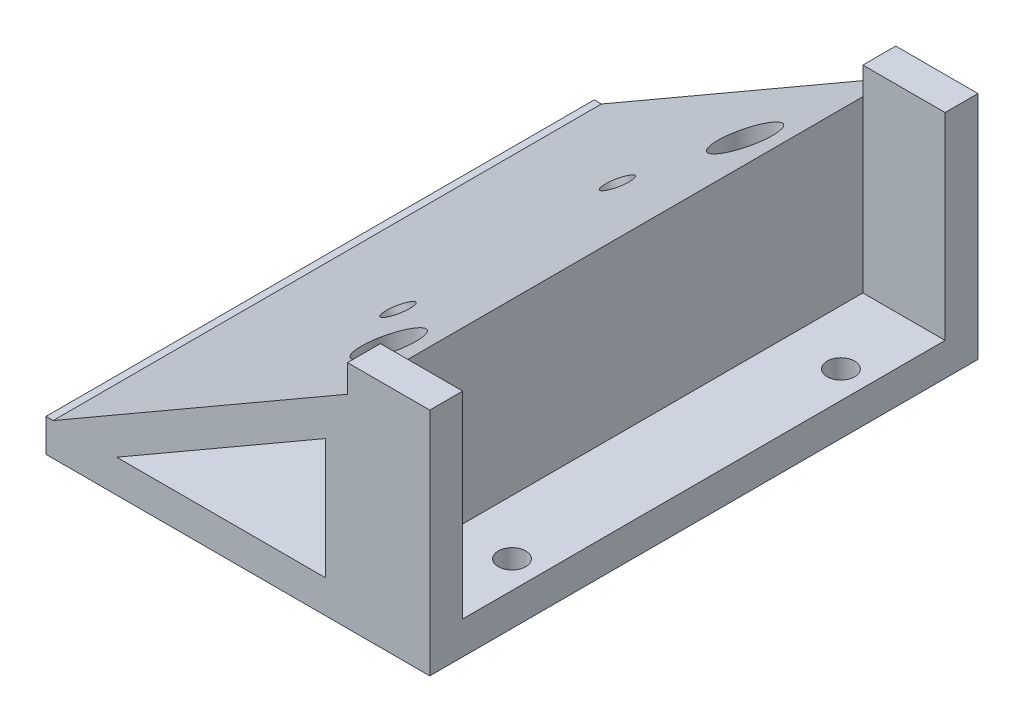
from build123d import *

# Parameters (mm, degrees)
SKETCH1_W                      = 35
SKETCH1_H                      = 50
BOSS_EXTRUDE1_DEPTH            = 3
SKETCH2_R                      = 1.5
SKETCH2_R_2                    = 1.25
CUT_EXTRUDE1_DEPTH             = 129.025488887
BOSS_EXTRUDE2_DEPTH            = 50
CUT_EXTRUDE5_DEPTH             = 118.869347947
CUT_EXTRUDE6_DEPTH             = 129.925466083
CUT_EXTRUDE6_DEPTH_BACK        = 1
SKETCH8_R                      = 2.5
CUT_EXTRUDE7_REACH             = 118.722
SKETCH9_R                      = 1.25
SKETCH10_R                     = 2.5
CUT_EXTRUDE8_DEPTH             = 0.5
CUT_EXTRUDE8_DIRECTION_2_REACH = 118.701
SKETCH11_W                     = 7.5
SKETCH11_H                     = 3
BOSS_EXTRUDE3_DEPTH            = 18


with BuildPart() as part:
    # Sketch1 → Boss-Extrude1 (new body)
    with BuildSketch(Plane(origin=(0, 0, 0), x_dir=(1, 0, 0), z_dir=(0, 1, 0))):
        with Locations((-87.623418825, 48.010907537)):
            Rectangle(SKETCH1_W, SKETCH1_H)
    extrude(amount=BOSS_EXTRUDE1_DEPTH)

    # Sketch2 → Cut-Extrude1 (cut, through all)
    with BuildSketch(Plane(origin=(0, 3, 0), x_dir=(1, 0, 0), z_dir=(0, 1, 0))):
        with Locations((-82.623418825, 64.263988227)):
            Circle(SKETCH2_R)
        with Locations((-82.623418825, 31.763988227)):
            Circle(SKETCH2_R)
        with Locations((-72.623418825, 33.010907537)):
            Circle(SKETCH2_R_2)
        with Locations((-72.623418825, 63.010907537)):
            Circle(SKETCH2_R_2)
    extrude(amount=-CUT_EXTRUDE1_DEPTH, mode=Mode.SUBTRACT)

    # Sketch4 → Boss-Extrude2 (add)
    with BuildSketch(Plane.XY.offset(-23.010907537)):
        Polygon((-77.623418825, 3), (-104.470206342, 3), (-77.623418825, 18.5), align=None)
    extrude(amount=-BOSS_EXTRUDE2_DEPTH)

    # Sketch6 → Cut-Extrude5 (cut, through all)
    with BuildSketch(Plane.XY.offset(-23.010907537)):
        Polygon((-98.675977708, 3), (-79.623418825, 3), (-79.623418825, 14), align=None)
    extrude(amount=-CUT_EXTRUDE5_DEPTH, mode=Mode.SUBTRACT)

    # Sketch8 → Cut-Extrude6 (cut, two sides: drawn at the far end of the back side and taken through both)
    with BuildSketch(Plane(origin=(0, 3, 0), x_dir=(1, 0, 0), z_dir=(0, 1, 0)).offset(-CUT_EXTRUDE6_DEPTH_BACK)):
        with Locations((-82.623418825, 31.763988227)):
            Circle(SKETCH8_R)
        with Locations((-82.623418825, 64.263988227)):
            Circle(SKETCH8_R)
    extrude(amount=CUT_EXTRUDE6_DEPTH + CUT_EXTRUDE6_DEPTH_BACK, mode=Mode.SUBTRACT)

    # Sketch9 → Cut-Extrude7 (cut, up to next)
    with BuildSketch(Plane(origin=(-27.416589691, 47.486926315, 0), x_dir=(0.8660254037844415, 0.49999999999999506, 0), z_dir=(-0.49999999999999506, 0.8660254037844415, 0)), mode=Mode.PRIVATE) as cut_extrude7_sk1:
        with Locations((-69.973852631, 58.010907537)):
            Circle(SKETCH9_R)
    cut_extrude7_tool1 = extrude(cut_extrude7_sk1.sketch, amount=-CUT_EXTRUDE7_REACH, mode=Mode.PRIVATE) & part.part
    # Sketch9 → Cut-Extrude7 (cut, up to next)
    with BuildSketch(Plane(origin=(-27.416589691, 47.486926315, 0), x_dir=(0.8660254037844415, 0.49999999999999506, 0), z_dir=(-0.49999999999999506, 0.8660254037844415, 0)), mode=Mode.PRIVATE) as cut_extrude7_sk2:
        with Locations((-69.973852631, 38.010907537)):
            Circle(SKETCH9_R)
    cut_extrude7_tool2 = extrude(cut_extrude7_sk2.sketch, amount=-CUT_EXTRUDE7_REACH, mode=Mode.PRIVATE) & part.part
    add(cut_extrude7_tool1.solids().sort_by_distance((-88.015724, 12.5, -58.010908))[0], mode=Mode.SUBTRACT)
    add(cut_extrude7_tool2.solids().sort_by_distance((-88.015724, 12.5, -38.010908))[0], mode=Mode.SUBTRACT)

    # Sketch10 → Cut-Extrude8 (cut)
    with BuildSketch(Plane(origin=(-25.968032533, 44.977951719, 0), x_dir=(-0.8660254037844358, -0.5000000000000049, 0), z_dir=(0.5000000000000049, -0.8660254037844358, 0))):
        with Locations((69.973852631, 58.010907537)):
            Circle(SKETCH10_R)
        with Locations((69.973852631, 38.010907537)):
            Circle(SKETCH10_R)
    extrude(amount=-CUT_EXTRUDE8_DEPTH, mode=Mode.SUBTRACT)

    # Sketch10 → Cut-Extrude8 direction 2 (cut, up to next)
    with BuildSketch(Plane(origin=(-25.968032533, 44.977951719, 0), x_dir=(-0.8660254037844358, -0.5000000000000049, 0), z_dir=(0.5000000000000049, -0.8660254037844358, 0)), mode=Mode.PRIVATE) as cut_extrude8_direction_2_sk1:
        with Locations((69.973852631, 58.010907537)):
            Circle(SKETCH10_R)
    cut_extrude8_direction_2_tool1 = extrude(cut_extrude8_direction_2_sk1.sketch, amount=CUT_EXTRUDE8_DIRECTION_2_REACH, mode=Mode.PRIVATE) & part.part
    # Sketch10 → Cut-Extrude8 direction 2 (cut, up to next)
    with BuildSketch(Plane(origin=(-25.968032533, 44.977951719, 0), x_dir=(-0.8660254037844358, -0.5000000000000049, 0), z_dir=(0.5000000000000049, -0.8660254037844358, 0)), mode=Mode.PRIVATE) as cut_extrude8_direction_2_sk2:
        with Locations((69.973852631, 38.010907537)):
            Circle(SKETCH10_R)
    cut_extrude8_direction_2_tool2 = extrude(cut_extrude8_direction_2_sk2.sketch, amount=CUT_EXTRUDE8_DIRECTION_2_REACH, mode=Mode.PRIVATE) & part.part
    add(cut_extrude8_direction_2_tool1.solids().sort_by_distance((-86.567167, 9.991025, -58.010908))[0], mode=Mode.SUBTRACT)
    add(cut_extrude8_direction_2_tool2.solids().sort_by_distance((-86.567167, 9.991025, -38.010908))[0], mode=Mode.SUBTRACT)

    # Sketch11 → Boss-Extrude3 (add)
    with BuildSketch(Plane(origin=(0, 3, 0), x_dir=(1, 0, 0), z_dir=(0, 1, 0))):
        with Locations((-73.873418825, 24.510907537)):
            Rectangle(SKETCH11_W, SKETCH11_H)
        with Locations((-73.873418825, 71.510907537)):
            Rectangle(SKETCH11_W, SKETCH11_H)
    extrude(amount=BOSS_EXTRUDE3_DEPTH)


solid = part.part
